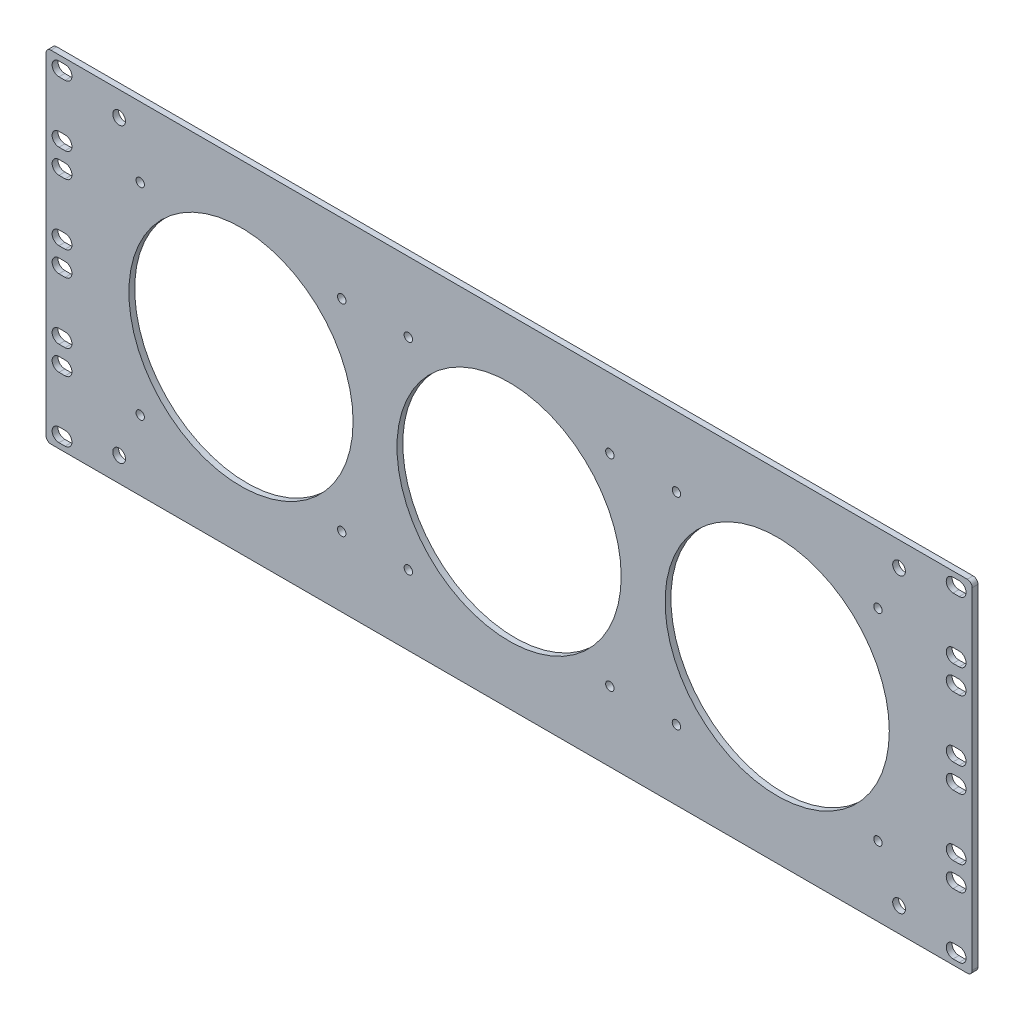
from build123d import *

# Parameters (mm, degrees)
ESQUISSE1_W               = 482.6
ESQUISSE1_H               = 177.8
T_LE_DE_BASE_PLI_E1_DEPTH = 3.03784
ENL_V_MAT_EXTRU_1_DEPTH   = 258.173343237
CONG_1_R                  = 2.54
ESQUISSE5_R               = 58.42
ENL_V_MAT_EXTRU_2_DEPTH   = 258.173343237
ESQUISSE6_R               = 2.1844
ENL_V_MAT_EXTRU_3_DEPTH   = 258.173343237
ESQUISSE7_R               = 3.317875
ENL_V_MAT_EXTRU_4_DEPTH   = 258.173343237


# Sheet-metal steps are written as plain solids
with BuildPart() as part:
    # Esquisse1 → Tôle de base pliée1 (new body)
    with BuildSketch(Plane.XY):
        Rectangle(ESQUISSE1_W, ESQUISSE1_H)
    extrude(amount=-T_LE_DE_BASE_PLI_E1_DEPTH)

    # Esquisse4 → Enlèv. mat.-Extru.1 (cut, through all)
    with BuildSketch(Plane.XY):
        with BuildLine():
            Line((-234.536234, -78.978125), (-231.361234, -78.978125))
            ThreePointArc((-231.361234, -78.978125), (-227.789359, -82.55), (-231.361234, -86.121875))
            Line((-231.361234, -86.121875), (-234.536234, -86.121875))
            ThreePointArc((-234.536234, -86.121875), (-238.108109, -82.55), (-234.536234, -78.978125))
        make_face()
        with BuildLine():
            Line((-234.536234, 86.121875), (-231.361234, 86.121875))
            ThreePointArc((-231.361234, 86.121875), (-227.789359, 82.55), (-231.361234, 78.978125))
            Line((-231.361234, 78.978125), (-234.536234, 78.978125))
            ThreePointArc((-234.536234, 78.978125), (-238.108109, 82.55), (-234.536234, 86.121875))
        make_face()
        with BuildLine():
            Line((231.361234, 86.121875), (234.536234, 86.121875))
            ThreePointArc((234.536234, 86.121875), (238.108109, 82.55), (234.536234, 78.978125))
            Line((234.536234, 78.978125), (231.361234, 78.978125))
            ThreePointArc((231.361234, 78.978125), (227.789359, 82.55), (231.361234, 86.121875))
        make_face()
        with BuildLine():
            Line((231.361234, -78.978125), (234.536234, -78.978125))
            ThreePointArc((234.536234, -78.978125), (238.108109, -82.55), (234.536234, -86.121875))
            Line((234.536234, -86.121875), (231.361234, -86.121875))
            ThreePointArc((231.361234, -86.121875), (227.789359, -82.55), (231.361234, -78.978125))
        make_face()
        with BuildLine():
            Line((-234.536234, -34.528125), (-231.361234, -34.528125))
            ThreePointArc((-231.361234, -34.528125), (-227.789359, -38.1), (-231.361234, -41.671875))
            Line((-231.361234, -41.671875), (-234.536234, -41.671875))
            ThreePointArc((-234.536234, -41.671875), (-238.108109, -38.1), (-234.536234, -34.528125))
        make_face()
        with BuildLine():
            Line((-234.536234, -47.228125), (-231.361234, -47.228125))
            ThreePointArc((-231.361234, -47.228125), (-227.789359, -50.8), (-231.361234, -54.371875))
            Line((-231.361234, -54.371875), (-234.536234, -54.371875))
            ThreePointArc((-234.536234, -54.371875), (-238.108109, -50.8), (-234.536234, -47.228125))
        make_face()
        with BuildLine():
            Line((231.361234, -47.228125), (234.536234, -47.228125))
            ThreePointArc((234.536234, -47.228125), (238.108109, -50.8), (234.536234, -54.371875))
            Line((234.536234, -54.371875), (231.361234, -54.371875))
            ThreePointArc((231.361234, -54.371875), (227.789359, -50.8), (231.361234, -47.228125))
        make_face()
        with BuildLine():
            Line((231.361234, -34.528125), (234.536234, -34.528125))
            ThreePointArc((234.536234, -34.528125), (238.108109, -38.1), (234.536234, -41.671875))
            Line((234.536234, -41.671875), (231.361234, -41.671875))
            ThreePointArc((231.361234, -41.671875), (227.789359, -38.1), (231.361234, -34.528125))
        make_face()
        with BuildLine():
            Line((-234.536234, 9.921875), (-231.361234, 9.921875))
            ThreePointArc((-231.361234, 9.921875), (-227.789359, 6.35), (-231.361234, 2.778125))
            Line((-231.361234, 2.778125), (-234.536234, 2.778125))
            ThreePointArc((-234.536234, 2.778125), (-238.108109, 6.35), (-234.536234, 9.921875))
        make_face()
        with BuildLine():
            Line((-234.536234, -2.778125), (-231.361234, -2.778125))
            ThreePointArc((-231.361234, -2.778125), (-227.789359, -6.35), (-231.361234, -9.921875))
            Line((-231.361234, -9.921875), (-234.536234, -9.921875))
            ThreePointArc((-234.536234, -9.921875), (-238.108109, -6.35), (-234.536234, -2.778125))
        make_face()
        with BuildLine():
            Line((231.361234, 54.371875), (234.536234, 54.371875))
            ThreePointArc((234.536234, 54.371875), (238.108109, 50.8), (234.536234, 47.228125))
            Line((234.536234, 47.228125), (231.361234, 47.228125))
            ThreePointArc((231.361234, 47.228125), (227.789359, 50.8), (231.361234, 54.371875))
        make_face()
        with BuildLine():
            Line((231.361234, 41.671875), (234.536234, 41.671875))
            ThreePointArc((234.536234, 41.671875), (238.108109, 38.1), (234.536234, 34.528125))
            Line((234.536234, 34.528125), (231.361234, 34.528125))
            ThreePointArc((231.361234, 34.528125), (227.789359, 38.1), (231.361234, 41.671875))
        make_face()
        with BuildLine():
            Line((-234.536234, 54.371875), (-231.361234, 54.371875))
            ThreePointArc((-231.361234, 54.371875), (-227.789359, 50.8), (-231.361234, 47.228125))
            Line((-231.361234, 47.228125), (-234.536234, 47.228125))
            ThreePointArc((-234.536234, 47.228125), (-238.108109, 50.8), (-234.536234, 54.371875))
        make_face()
        with BuildLine():
            Line((-234.536234, 41.671875), (-231.361234, 41.671875))
            ThreePointArc((-231.361234, 41.671875), (-227.789359, 38.1), (-231.361234, 34.528125))
            Line((-231.361234, 34.528125), (-234.536234, 34.528125))
            ThreePointArc((-234.536234, 34.528125), (-238.108109, 38.1), (-234.536234, 41.671875))
        make_face()
        with BuildLine():
            Line((231.361234, 9.921875), (234.536234, 9.921875))
            ThreePointArc((234.536234, 9.921875), (238.108109, 6.35), (234.536234, 2.778125))
            Line((234.536234, 2.778125), (231.361234, 2.778125))
            ThreePointArc((231.361234, 2.778125), (227.789359, 6.35), (231.361234, 9.921875))
        make_face()
        with BuildLine():
            Line((231.361234, -2.778125), (234.536234, -2.778125))
            ThreePointArc((234.536234, -2.778125), (238.108109, -6.35), (234.536234, -9.921875))
            Line((234.536234, -9.921875), (231.361234, -9.921875))
            ThreePointArc((231.361234, -9.921875), (227.789359, -6.35), (231.361234, -2.778125))
        make_face()
    extrude(amount=-ENL_V_MAT_EXTRU_1_DEPTH, mode=Mode.SUBTRACT)

    # Congé1
    cong_1_edges = [part.edges().sort_by_distance(p)[0] for p in [
        (-241.3, 88.9, -1.51892),
        (241.3, 88.9, -1.51892),
        (241.3, -88.9, -1.51892),
        (-241.3, -88.9, -1.51892),
    ]]
    fillet(cong_1_edges, radius=CONG_1_R)

    # Esquisse5 → Enlèv. mat.-Extru.2 (cut, through all)
    with BuildSketch(Plane.XY):
        Circle(ESQUISSE5_R)
        with Locations((-139.7, 0)):
            Circle(ESQUISSE5_R)
        with Locations((139.7, 0)):
            Circle(ESQUISSE5_R)
    extrude(amount=-ENL_V_MAT_EXTRU_2_DEPTH, mode=Mode.SUBTRACT)

    # Esquisse6 → Enlèv. mat.-Extru.3 (cut, through all)
    with BuildSketch(Plane(origin=(0, 0, -3.03784), x_dir=(-1, 0, 0), z_dir=(0, 0, -1))):
        with Locations((-192.2, 52.5)):
            Circle(ESQUISSE6_R)
        with Locations((-87.2, 52.5)):
            Circle(ESQUISSE6_R)
        with Locations((-52.5, 52.5)):
            Circle(ESQUISSE6_R)
        with Locations((-87.2, -52.5)):
            Circle(ESQUISSE6_R)
        with Locations((-52.5, -52.5)):
            Circle(ESQUISSE6_R)
        with Locations((-192.2, -52.5)):
            Circle(ESQUISSE6_R)
        with Locations((52.5, 52.5)):
            Circle(ESQUISSE6_R)
        with Locations((52.5, -52.5)):
            Circle(ESQUISSE6_R)
        with Locations((87.2, -52.5)):
            Circle(ESQUISSE6_R)
        with Locations((87.2, 52.5)):
            Circle(ESQUISSE6_R)
        with Locations((192.2, 52.5)):
            Circle(ESQUISSE6_R)
        with Locations((192.2, -52.5)):
            Circle(ESQUISSE6_R)
    extrude(amount=-ENL_V_MAT_EXTRU_3_DEPTH, mode=Mode.SUBTRACT)

    # Esquisse7 → Enlèv. mat.-Extru.4 (cut, through all)
    with BuildSketch(Plane.XY):
        with Locations((-203.2, 76.2)):
            Circle(ESQUISSE7_R)
        with Locations((-203.2, -76.2)):
            Circle(ESQUISSE7_R)
        with Locations((203.2, -76.2)):
            Circle(ESQUISSE7_R)
        with Locations((203.2, 76.2)):
            Circle(ESQUISSE7_R)
    extrude(amount=-ENL_V_MAT_EXTRU_4_DEPTH, mode=Mode.SUBTRACT)


solid = part.part
